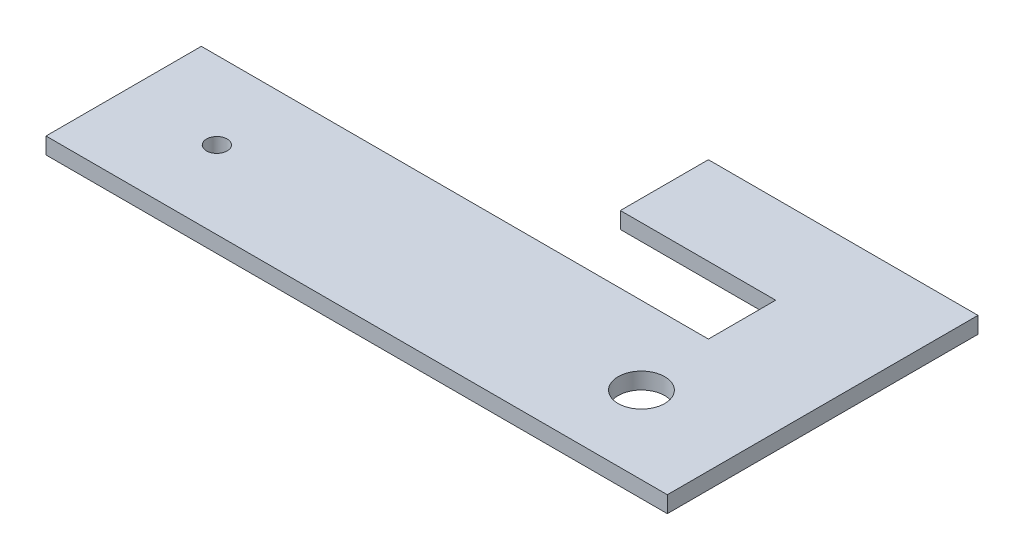
from build123d import *

# Parameters (mm, degrees)
SKETCH1_W           = 120
SKETCH1_H           = 30
BOSS_EXTRUDE1_DEPTH = 3.175
SKETCH2_R           = 2
SKETCH2_R_2         = 4.5
CUT_EXTRUDE1_DEPTH  = 3.175
SKETCH3_W           = 22.072613883
SKETCH3_H           = 3.175
BOSS_EXTRUDE2_DEPTH = 30
SKETCH4_R           = 1.381817411
CUT_EXTRUDE2_DEPTH  = 10
SKETCH7_R           = 1.381817411
BOSS_EXTRUDE4_DEPTH = 3.175
SKETCH10_W          = 17
SKETCH10_H          = 3.175
BOSS_EXTRUDE7_DEPTH = 30


with BuildPart() as part:
    # Sketch1 → Boss-Extrude1 (new body)
    with BuildSketch(Plane(origin=(0, 0, 0), x_dir=(1, 0, 0), z_dir=(0, 1, 0))):
        with Locations((60, 15)):
            Rectangle(SKETCH1_W, SKETCH1_H)
    extrude(amount=BOSS_EXTRUDE1_DEPTH)

    # Sketch2 → Cut-Extrude1 (cut)
    with BuildSketch(Plane(origin=(0, 3.175, 0), x_dir=(1, 0, 0), z_dir=(0, 1, 0))):
        with Locations((18, 15)):
            Circle(SKETCH2_R)
        with Locations((100, 15)):
            Circle(SKETCH2_R_2)
    extrude(amount=-CUT_EXTRUDE1_DEPTH, mode=Mode.SUBTRACT)

    # Sketch3 → Boss-Extrude2 (add)
    with BuildSketch(Plane(origin=(0, 0, -30), x_dir=(-1, 0, 0), z_dir=(0, 0, -1))):
        with Locations((-108.963693059, 1.5875)):
            Rectangle(SKETCH3_W, SKETCH3_H)
    extrude(amount=BOSS_EXTRUDE2_DEPTH)

    # Sketch4 → Cut-Extrude2 (cut)
    with BuildSketch(Plane(origin=(0, 3.175, 0), x_dir=(1, 0, 0), z_dir=(0, 1, 0))):
        with Locations((101.927386117, 38)):
            Circle(SKETCH4_R)
    extrude(amount=-CUT_EXTRUDE2_DEPTH, mode=Mode.SUBTRACT)

    # Sketch7 → Boss-Extrude4 (add)
    with BuildSketch(Plane(origin=(0, 3.175, 0), x_dir=(1, 0, 0), z_dir=(0, 1, 0))):
        with Locations((101.927386117, 38)):
            Circle(SKETCH7_R)
    extrude(amount=-BOSS_EXTRUDE4_DEPTH)

    # Sketch10 → Boss-Extrude7 (add)
    with BuildSketch(Plane.ZY.offset(-97.927386117)):
        with Locations((-51.5, 1.5875)):
            Rectangle(SKETCH10_W, SKETCH10_H)
    extrude(amount=BOSS_EXTRUDE7_DEPTH)


solid = part.part
